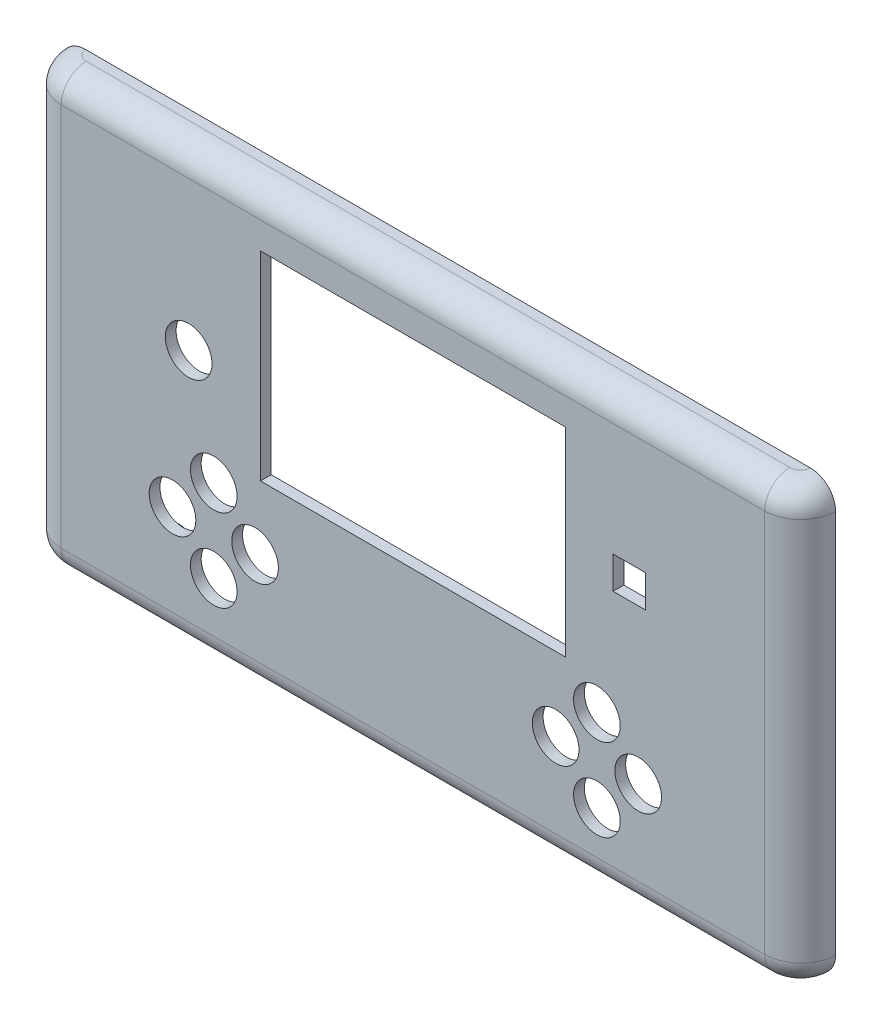
from build123d import *

# Parameters (mm, degrees)
SKETCH_1_W          = 210
SKETCH_1_H          = 115
EXTRUDE_6_DEPTH     = 6.75
FILLET_6_R          = 7
FILLET_7_R          = 4
SHELL_6_T           = 3
SKETCH_10_W         = 85
SKETCH_10_H         = 55.5
CUT_EXTRUDE_1_DEPTH = 125.175690155
SKETCH_11_R         = 6.5
SKETCH_11_W         = 9
SKETCH_11_H         = 9
CUT_EXTRUDE_2_DEPTH = 125.175690155
SKETCH_12_R         = 4.5
SKETCH_12_R_2       = 1.5
EXTRUDE_9_DEPTH     = 6


with BuildPart() as part:
    # Эскиз1 → Бобышка-Вытянуть6 (new body)
    with BuildSketch(Plane.XY):
        Rectangle(SKETCH_1_W, SKETCH_1_H)
    extrude(amount=EXTRUDE_6_DEPTH)

    # Скругление6
    # the kernel refuses this fillet: 7 mm, written as the material it takes off along each edge
    with BuildSketch(Plane(origin=(105, 74.988835725, 6.75), x_dir=(0, 0, -1), z_dir=(0, -1, 0)), Plane(origin=(-105, -74.988835725, 6.75), x_dir=(0, 0, -1), z_dir=(0, 1, 0))) as fillet_6_piece_1:
        with BuildLine():
            CenterArc((7, -6.99553429), FILLET_6_R, 92.046713098, 87.953286902)
            Line((0, -6.99553429), (-0.14, -6.99553429))
            Line((-0.14, -6.99553429), (-0.14, 0))
            Line((-0.14, 0), (0, 0.14))
            ThreePointArc((0, 0.14), (3.375, 0.14), (6.745, 0.139910686))
            Line((6.745, 0.139910686), (6.75, 0))
        make_face()
    extrude(amount=149.977671449, mode=Mode.SUBTRACT)

    # Скругление7
    fillet_7_edges = [part.edges().sort_by_distance(p)[0] for p in [
        (0, -57.5, 6.75),
        (0, 57.5, 6.75),
        (-102.865021234, 57.5, 4.78736042),
        (102.865021234, 57.5, 4.78736042),
        (-102.865021234, -57.5, 4.78736042),
        (102.865021234, -57.5, 4.78736042),
    ]]
    fillet(fillet_7_edges, radius=FILLET_7_R)

    # Оболочка6
    shell_6_openings = [part.faces().sort_by_distance(p)[0] for p in [
        (0, -1.3e-08, 0),
    ]]
    offset(amount=SHELL_6_T, openings=shell_6_openings, kind=Kind.INTERSECTION)

    # Эскиз10 → Вырез-Вытянуть1 (cut, through all)
    with BuildSketch(Plane.XY.offset(9.75)):
        with Locations((0, 18.25)):
            Rectangle(SKETCH_10_W, SKETCH_10_H)
    extrude(amount=-CUT_EXTRUDE_1_DEPTH, mode=Mode.SUBTRACT)

    # Эскиз11 → Вырез-Вытянуть2 (cut, through all)
    with BuildSketch(Plane.XY.offset(9.75)):
        with Locations((-44, -28)):
            Circle(SKETCH_11_R)
        with Locations((-55.5, -39.5)):
            Circle(SKETCH_11_R)
        with Locations((-55.5, -16.5)):
            Circle(SKETCH_11_R)
        with Locations((-67, -28)):
            Circle(SKETCH_11_R)
        with Locations((51.25, -18.5)):
            Circle(SKETCH_11_R)
        with Locations((62.75, -30)):
            Circle(SKETCH_11_R)
        with Locations((51.25, -41.5)):
            Circle(SKETCH_11_R)
        with Locations((39.75, -30)):
            Circle(SKETCH_11_R)
        with Locations((-62.5, 12)):
            Circle(SKETCH_11_R)
        with Locations((60.25, 17.5)):
            Rectangle(SKETCH_11_W, SKETCH_11_H)
    extrude(amount=-CUT_EXTRUDE_2_DEPTH, mode=Mode.SUBTRACT)

    # Эскиз12 → Бобышка-Вытянуть9 (add)
    # profile 1 of 4: a face of its own
    with BuildSketch(Plane(origin=(0, 0, 6.75), x_dir=(-1, 0, 0), z_dir=(0, 0, -1))):
        with Locations(Location((74, 37.5, 0), (0, 0, 180))):
            Circle(SKETCH_12_R)
        with Locations((74, 37.5)):
            Circle(SKETCH_12_R_2, mode=Mode.SUBTRACT)
    # profile 2 of 4: a face of its own
    with BuildSketch(Plane(origin=(0, 0, 6.75), x_dir=(-1, 0, 0), z_dir=(0, 0, -1))):
        with Locations(Location((-68.75, 37.5, 0), (0, 0, 180))):
            Circle(SKETCH_12_R)
        with Locations((-68.75, 37.5)):
            Circle(SKETCH_12_R_2, mode=Mode.SUBTRACT)
    # profile 3 of 4: a face of its own
    with BuildSketch(Plane(origin=(0, 0, 6.75), x_dir=(-1, 0, 0), z_dir=(0, 0, -1))):
        with Locations(Location((74, -44.75, 0), (0, 0, 180))):
            Circle(SKETCH_12_R)
        with Locations((74, -44.75)):
            Circle(SKETCH_12_R_2, mode=Mode.SUBTRACT)
    # profile 4 of 4: a face of its own
    with BuildSketch(Plane(origin=(0, 0, 6.75), x_dir=(-1, 0, 0), z_dir=(0, 0, -1))):
        with Locations(Location((-68.75, -44.75, 0), (0, 0, 180))):
            Circle(SKETCH_12_R)
        with Locations((-68.75, -44.75)):
            Circle(SKETCH_12_R_2, mode=Mode.SUBTRACT)
    extrude(amount=EXTRUDE_9_DEPTH)


solid = part.part
